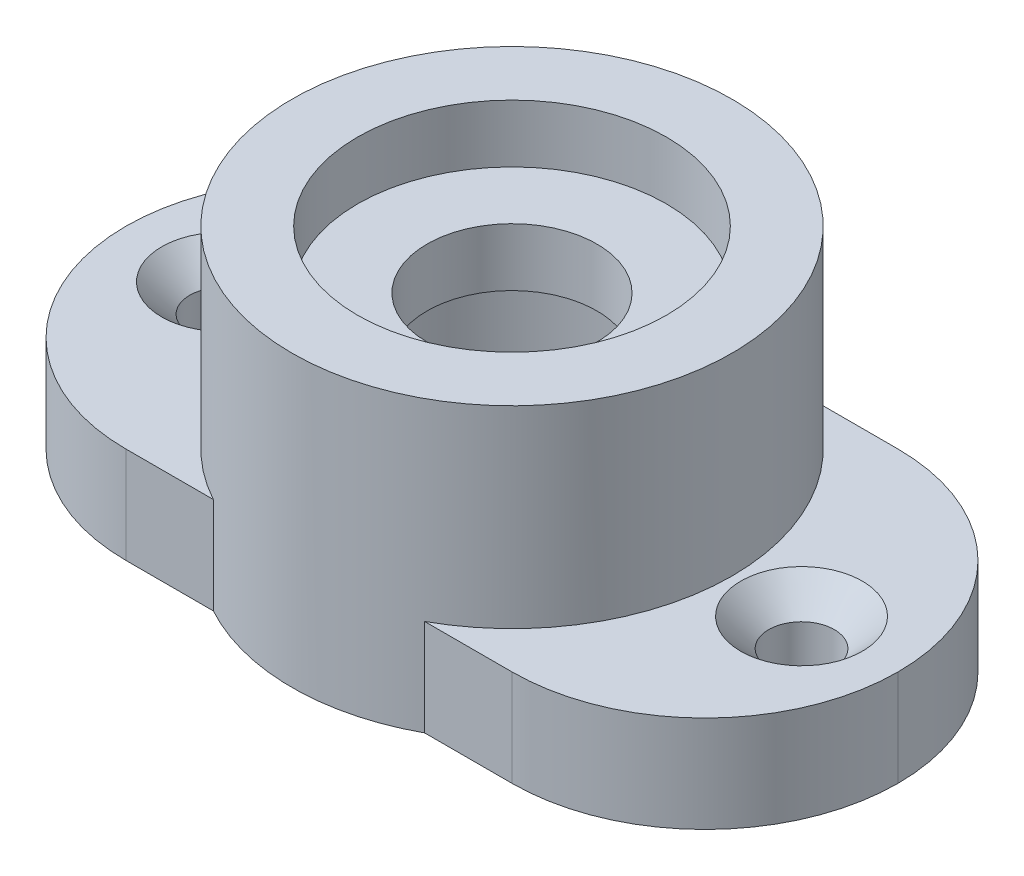
from build123d import *
from build123d.topology import SkipClean

# Parameters (mm, degrees)
SKETCH1_W                                       = 40
SKETCH1_H                                       = 20
BOSS_EXTRUDE1_DEPTH                             = 5
CSK_FOR_M3_FLAT_HEAD_MACHINE_SCREW1_D           = 3.4
CSK_FOR_M3_FLAT_HEAD_MACHINE_SCREW1_CSINK_D     = 6.3
CSK_FOR_M3_FLAT_HEAD_MACHINE_SCREW1_CSINK_ANGLE = 90
SKETCH4_R                                       = 4.4
CUT_EXTRUDE1_DEPTH                              = 5
BOSS_EXTRUDE2_START                             = 10
SKETCH5_R                                       = 11.4
SKETCH5_R_2                                     = 4.4
BOSS_EXTRUDE2_DEPTH                             = 10
FILLET1_R                                       = 10
SKETCH6_R                                       = 8
SKETCH6_R_2                                     = 4.4
CUT_EXTRUDE2_DEPTH                              = 3
CUT_EXTRUDE3_START                              = -9
SKETCH7_R                                       = 8
CUT_EXTRUDE3_DEPTH                              = 9
BOSS_EXTRUDE3_START                             = -5
BOSS_EXTRUDE3_DEPTH                             = 5


with BuildPart() as part:
    # Sketch1 → Boss-Extrude1 (new body)
    with BuildSketch(Plane(origin=(0, 0, 0), x_dir=(1, 0, 0), z_dir=(0, 1, 0))):
        Rectangle(SKETCH1_W, SKETCH1_H)
    extrude(amount=BOSS_EXTRUDE1_DEPTH)

    # CSK for M3 Flat Head Machine Screw1 (through all)
    with Locations(Plane(origin=(0, 5, 0), x_dir=(1, 0, 0), z_dir=(0, 1, 0))):
        with Locations((15, 0), (-15, 0)):
            CounterSinkHole(CSK_FOR_M3_FLAT_HEAD_MACHINE_SCREW1_D / 2, CSK_FOR_M3_FLAT_HEAD_MACHINE_SCREW1_CSINK_D / 2, counter_sink_angle=CSK_FOR_M3_FLAT_HEAD_MACHINE_SCREW1_CSINK_ANGLE)

    # Sketch4 → Cut-Extrude1 (cut)
    with BuildSketch(Plane(origin=(0, 5, 0), x_dir=(1, 0, 0), z_dir=(0, 1, 0))):
        with Locations(Location((0, 0, 0), (0, 0, 270))):
            Circle(SKETCH4_R)
    extrude(amount=-CUT_EXTRUDE1_DEPTH, mode=Mode.SUBTRACT)

    # Sketch5 → Boss-Extrude2 (add)
    with BuildSketch(Plane(origin=(0, 5, 0), x_dir=(1, 0, 0), z_dir=(0, 1, 0)).offset(BOSS_EXTRUDE2_START)):
        with Locations(Location((0, 0, 0), (0, 0, 61.305586473))):
            Circle(SKETCH5_R)
        with Locations(Location((0, 0, 0), (0, 0, 270))):
            Circle(SKETCH5_R_2, mode=Mode.SUBTRACT)
    extrude(amount=-BOSS_EXTRUDE2_DEPTH)

    # Fillet1
    fillet1_edges = [part.edges().sort_by_distance(p)[0] for p in [
        (20, 2.5, 10),
        (-20, 2.5, -10),
        (20, 2.5, -10),
        (-20, 2.5, 10),
    ]]
    fillet(fillet1_edges, radius=FILLET1_R - 0.0001)  # a hair under: the kernel refuses the full size

    # Sketch6 → Cut-Extrude2 (cut)
    with BuildSketch(Plane(origin=(0, 15, 0), x_dir=(1, 0, 0), z_dir=(0, 1, 0))):
        with Locations(Location((0, 0, 0), (0, 0, 270))):
            Circle(SKETCH6_R)
        with Locations(Location((0, 0, 0), (0, 0, 270))):
            Circle(SKETCH6_R_2, mode=Mode.SUBTRACT)
    extrude(amount=-CUT_EXTRUDE2_DEPTH, mode=Mode.SUBTRACT)

    # Sketch7 → Cut-Extrude3 (cut)
    with BuildSketch(Plane.XZ.offset(CUT_EXTRUDE3_START)):
        with Locations(Location((0, 0, 0), (0, 0, 90))):
            Circle(SKETCH7_R)
    extrude(amount=CUT_EXTRUDE3_DEPTH, mode=Mode.SUBTRACT)

    # Sketch8 → Boss-Extrude3 (add)
    with SkipClean():  # the faces are left unmerged after this step: merging them gives an invalid solid
        with BuildSketch(Plane.XZ.offset(BOSS_EXTRUDE3_START)):
            with BuildLine():
                Line((-5.473572873, 10), (5.473572873, 10))
                ThreePointArc((5.473572873, 10), (0, 11.4), (-5.473572873, 10))
            make_face()
            with BuildLine():
                Line((-5.473572873, -10), (5.473572873, -10))
                ThreePointArc((5.473572873, -10), (0, -11.4), (-5.473572873, -10))
            make_face()
        extrude(amount=BOSS_EXTRUDE3_DEPTH)


solid = part.part
